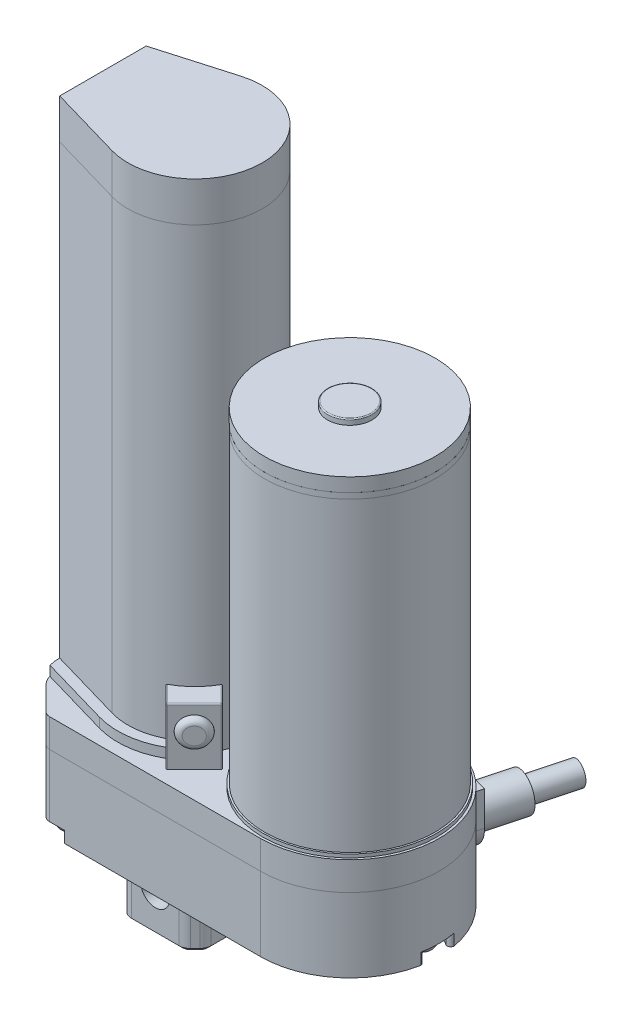
from build123d import *

# Parameters (mm, degrees)
BOSS_EXTRUDE1_DEPTH      = 6.35
SKETCH6_R                = 19.431
BOSS_EXTRUDE4_DEPTH      = 0.762
SKETCH7_R                = 19.05
BOSS_EXTRUDE5_DEPTH      = 68.326
FILLET6_R                = 5.08
FILLET7_R                = 1.905
BOSS_EXTRUDE15_DEPTH     = 6.35
SKETCH24_R               = 4.064
BOSS_EXTRUDE16_DEPTH     = 10.16
SKETCH25_R               = 2.54
BOSS_EXTRUDE17_DEPTH     = 10.16
BOSS_EXTRUDE19_DEPTH     = 16.51
FILLET13_R               = 1.905
FILLET14_R               = 5.08
BOSS_EXTRUDE20_DEPTH     = 18.796
CHAMFER1_SIZE            = 2.54
FILLET15_R               = 2.54
CHAMFER2_SIZE            = 0.762
SKETCH27_R               = 3.175
CUT_EXTRUDE3_DEPTH       = 19.05
SKETCH28_R               = 19.05
BOSS_EXTRUDE22_DEPTH     = 1.27
SKETCH29_R               = 19.05
BOSS_EXTRUDE24_DEPTH     = 3.048
BOSS_EXTRUDE25_START     = 4.318
SKETCH8_R                = 4.953
BOSS_EXTRUDE25_DEPTH     = 1.27
FILLET16_R               = 0.2286
BOSS_EXTRUDE26_DEPTH     = 101.981
BOSS_EXTRUDE27_DEPTH     = 8.89
SKETCH33_R               = 9.906
BOSS_EXTRUDE28_DEPTH     = 21.336
BOSS_EXTRUDE30_DEPTH     = 2.159
BOSS_EXTRUDE31_DEPTH     = 2.159
BOSS_EXTRUDE33_DEPTH     = 12.7
BOSS_EXTRUDE33_2_DEPTH   = 12.7
FILLET17_R               = 0.2286
FILLET18_R               = 0.2286
SKETCH43_R               = 3.175
BOSS_EXTRUDE34_DEPTH     = 1.27
FILLET19_R               = 1.27
SKETCH44_R               = 3.175
BOSS_EXTRUDE35_DEPTH     = 1.27
FILLET20_R               = 1.27
CUT_EXTRUDE5_START       = -2.54
CUT_EXTRUDE5_DEPTH       = 2.54
CUT_EXTRUDE6_START       = -2.54
CUT_EXTRUDE6_DEPTH       = 2.54
SKETCH47_R               = 2.54
BOSS_EXTRUDE36_DEPTH     = 2.54
BOSS_EXTRUDE36_2_DEPTH   = 2.54
BOSS_EXTRUDE36_3_DEPTH   = 2.54
FILLET22_R               = 1.524
FILLET23_R               = 1.524
SKETCH48_R               = 3.81
BOSS_EXTRUDE37_DEPTH     = 1.524
FILLET24_R               = 1.524
FILLET25_R               = 1.524
SKETCH49_R               = 3.81
CUT_EXTRUDE7_DEPTH       = 2.54
SKETCH50_R               = 3.556
BOSS_EXTRUDE39_DEPTH     = 2.54
CUT_EXTRUDE11_DEPTH      = 166.213624927
CUT_EXTRUDE11_DEPTH_BACK = 166.213624927
SKETCH52_R               = 3.175
SKETCH54_R               = 9.906
CUT_EXTRUDE12_DEPTH      = 21.336


with BuildPart() as part:
    # Sketch1 → Boss-Extrude1 (new body)
    with BuildSketch(Plane(origin=(0, 0, 0), x_dir=(1, 0, 0), z_dir=(0, 1, 0))):
        with BuildLine():
            Line((0, 32.639), (7.239, 39.878))
            Line((7.239, 39.878), (55.118, 39.878))
            ThreePointArc((55.118, 39.878), (75.057, 19.939), (55.118, 0))
            Line((55.118, 0), (7.239, 0))
            Line((7.239, 0), (0, 7.239))
            Line((0, 7.239), (0, 32.639))
        make_face()
    extrude(amount=BOSS_EXTRUDE1_DEPTH)

    # Fillet6
    fillet6_edges = [part.edges().sort_by_distance(p)[0] for p in [
        (0, 3.175, -7.239),
        (0, 3.175, -32.639),
    ]]
    fillet(fillet6_edges, radius=FILLET6_R)

    # Fillet7
    fillet7_edges = [part.edges().sort_by_distance(p)[0] for p in [
        (7.239, 3.175, 0),
        (7.239, 3.175, -39.878),
    ]]
    fillet(fillet7_edges, radius=FILLET7_R)


with BuildPart() as body_2:
    # Sketch6 → Boss-Extrude4 (new body)
    with BuildSketch(Plane(origin=(0, 6.35, 0), x_dir=(1, 0, 0), z_dir=(0, 1, 0))):
        with Locations(Location((55.118, 19.939, 0), (0, 0, 90))):
            Circle(SKETCH6_R)
    extrude(amount=BOSS_EXTRUDE4_DEPTH)


with BuildPart() as body_3:
    # Sketch7 → Boss-Extrude5 (new body)
    with BuildSketch(Plane(origin=(0, 7.112, 0), x_dir=(1, 0, 0), z_dir=(0, 1, 0))):
        with Locations(Location((55.118, 19.939, 0), (0, 0, 270))):
            Circle(SKETCH7_R)
    extrude(amount=BOSS_EXTRUDE5_DEPTH)


with BuildPart() as body_4:
    # Sketch23 → Boss-Extrude15 (new body)
    with BuildSketch(Plane(origin=(12.522748088, 0, -46.735532116), x_dir=(0, -1, 0), z_dir=(0.25881904510252135, 0, -0.9659258262890681))):
        with BuildLine():
            Line((-2.032, -53.883866243), (5.588, -53.883866243))
            ThreePointArc((5.588, -53.883866243), (11.303, -48.168866243), (5.588, -42.453866243))
            Line((5.588, -42.453866243), (-2.032, -42.453866243))
            Line((-2.032, -42.453866243), (-2.032, -53.883866243))
        make_face()
    extrude(amount=BOSS_EXTRUDE15_DEPTH)

    # Sketch24 → Boss-Extrude16 (add)
    with BuildSketch(Plane(origin=(14.166249025, 0, -52.869161113), x_dir=(-0.9659258262890682, 0, -0.25881904510252135), z_dir=(0.2588190451025213, 0, -0.9659258262890681))):
        with Locations((-48.168866243, -5.588)):
            Circle(SKETCH24_R)
    extrude(amount=BOSS_EXTRUDE16_DEPTH)

    # Sketch25 → Boss-Extrude17 (add)
    with BuildSketch(Plane(origin=(16.795850523, 0, -62.682967508), x_dir=(-0.9659258262890681, 0, -0.25881904510252135), z_dir=(0.25881904510252135, 0, -0.9659258262890681))):
        with Locations((-48.168866243, -5.588)):
            Circle(SKETCH25_R)
    extrude(amount=BOSS_EXTRUDE17_DEPTH)


with BuildPart() as body_5:
    # Sketch1<3> → Boss-Extrude19 (new body)
    with BuildSketch(Plane(origin=(0, 0, 0), x_dir=(1, 0, 0), z_dir=(0, 1, 0))):
        with BuildLine():
            Line((0, 32.639), (7.239, 39.878))
            Line((7.239, 39.878), (55.118, 39.878))
            ThreePointArc((55.118, 39.878), (75.057, 19.939), (55.118, 0))
            Line((55.118, 0), (7.239, 0))
            Line((7.239, 0), (0, 7.239))
            Line((0, 7.239), (0, 32.639))
        make_face()
    extrude(amount=-BOSS_EXTRUDE19_DEPTH)

    # Fillet13
    fillet13_edges = [body_5.edges().sort_by_distance(p)[0] for p in [
        (7.239, -8.255, 0),
        (7.239, -8.255, -39.878),
    ]]
    fillet(fillet13_edges, radius=FILLET13_R)

    # Fillet14
    fillet14_edges = [body_5.edges().sort_by_distance(p)[0] for p in [
        (0, -8.255, -7.239),
        (0, -8.255, -32.639),
    ]]
    fillet(fillet14_edges, radius=FILLET14_R)

    # Sketch45 → Cut-Extrude5 (cut)
    with BuildSketch(Plane.XZ.offset(16.51).offset(CUT_EXTRUDE5_START)):
        with BuildLine():
            ThreePointArc((5.044290367, -35.978344089), (4.718699387, -36.549691761), (4.084467985, -36.723467985))
            Line((4.084467985, -36.723467985), (6.681038418, -39.320038418))
            ThreePointArc((6.681038418, -39.320038418), (7.299064898, -39.732990509), (8.028076836, -39.878))
            Line((8.028076836, -39.878), (11.393838428, -39.878))
            ThreePointArc((11.393838428, -39.878), (11.138454644, -39.419455597), (11.282110896, -38.914632134))
            ThreePointArc((11.282110896, -38.914632134), (10.476958507, -32.531164357), (5.044290367, -35.978344089))
        make_face()
        with BuildLine():
            ThreePointArc((11.282110896, -0.963367866), (11.138454644, -0.458544403), (11.393838428, 0))
            Line((11.393838428, 0), (8.028076836, 0))
            ThreePointArc((8.028076836, 0), (7.299064898, -0.145009491), (6.681038418, -0.557961582))
            Line((6.681038418, -0.557961582), (4.084467985, -3.154532015))
            ThreePointArc((4.084467985, -3.154532015), (4.718699387, -3.328308239), (5.044290367, -3.899655911))
            ThreePointArc((5.044290367, -3.899655911), (10.476958507, -7.346835643), (11.282110896, -0.963367866))
        make_face()
    extrude(amount=CUT_EXTRUDE5_DEPTH, mode=Mode.SUBTRACT)

    # Sketch45<3> → Cut-Extrude6 (cut)
    with BuildSketch(Plane.XZ.offset(16.51).offset(CUT_EXTRUDE6_START)):
        with BuildLine():
            Line((4.084467985, -36.723467985), (6.681038418, -39.320038418))
            ThreePointArc((6.681038418, -39.320038418), (7.299064898, -39.732990509), (8.028076836, -39.878))
            Line((8.028076836, -39.878), (11.393838428, -39.878))
            ThreePointArc((11.393838428, -39.878), (11.138454644, -39.419455597), (11.282110896, -38.914632134))
            ThreePointArc((11.282110896, -38.914632134), (10.476958507, -32.531164357), (5.044290367, -35.978344089))
            ThreePointArc((5.044290367, -35.978344089), (4.718699387, -36.549691761), (4.084467985, -36.723467985))
        make_face()
        with BuildLine():
            Line((11.393838428, 0), (8.028076836, 0))
            ThreePointArc((8.028076836, 0), (7.299064898, -0.145009491), (6.681038418, -0.557961582))
            Line((6.681038418, -0.557961582), (4.084467985, -3.154532015))
            ThreePointArc((4.084467985, -3.154532015), (4.718699387, -3.328308239), (5.044290367, -3.899655911))
            ThreePointArc((5.044290367, -3.899655911), (10.476958507, -7.346835643), (11.282110896, -0.963367866))
            ThreePointArc((11.282110896, -0.963367866), (11.138454644, -0.458544403), (11.393838428, 0))
        make_face()
        with BuildLine():
            ThreePointArc((73.662109712, -16.992248385), (67.437, -19.939), (73.662109712, -22.885751615))
            ThreePointArc((73.662109712, -22.885751615), (74.341584064, -23.041280193), (74.712069674, -23.631716426))
            ThreePointArc((74.712069674, -23.631716426), (75.057, -19.939), (74.712069674, -16.246283574))
            ThreePointArc((74.712069674, -16.246283574), (74.341584064, -16.836719807), (73.662109712, -16.992248385))
        make_face()
    extrude(amount=CUT_EXTRUDE6_DEPTH, mode=Mode.SUBTRACT)


with BuildPart() as body_6:
    # Sketch26 → Boss-Extrude20 (new body)
    with BuildSketch(Plane(origin=(0, -16.51, 0), x_dir=(-1, 0, 0), z_dir=(0, -1, 0))):
        Polygon((-20.574, 28.829), (-11.684, 28.829), (-11.684, 11.049), (-29.464, 11.049), (-29.464, 28.829), align=None)
    extrude(amount=BOSS_EXTRUDE20_DEPTH)

    # Chamfer1
    chamfer1_edges = [body_6.edges().sort_by_distance(p)[0] for p in [
        (11.684, -25.908, -11.049),
        (29.464, -25.908, -11.049),
        (29.464, -25.908, -28.829),
        (11.684, -25.908, -28.829),
    ]]
    chamfer(chamfer1_edges, length=CHAMFER1_SIZE)

    # Fillet15
    fillet15_edges = [body_6.edges().sort_by_distance(p)[0] for p in [
        (29.464, -25.908, -13.589),
        (29.464, -25.908, -26.289),
        (14.224, -25.908, -28.829),
        (26.924, -25.908, -28.829),
        (14.224, -25.908, -11.049),
        (26.924, -25.908, -11.049),
        (11.684, -25.908, -26.289),
        (11.684, -25.908, -13.589),
    ]]
    fillet(fillet15_edges, radius=FILLET15_R)

    # Chamfer2
    chamfer2_edges = [body_6.edges().sort_by_distance(p)[0] for p in [
        (11.684, -35.306, -19.939),
        (12.954, -35.306, -12.319),
        (20.574, -35.306, -28.829),
        (28.194, -35.306, -27.559),
        (29.464, -35.306, -19.939),
        (28.194, -35.306, -12.319),
        (20.574, -35.306, -11.049),
        (12.954, -35.306, -27.559),
        (14.30408653, -35.306, -28.635654013),
        (11.877345987, -35.306, -26.20891347),
        (26.84391347, -35.306, -28.635654013),
        (29.270654013, -35.306, -26.20891347),
        (29.270654013, -35.306, -13.66908653),
        (26.84391347, -35.306, -11.242345987),
        (14.30408653, -35.306, -11.242345987),
        (11.877345987, -35.306, -13.66908653),
    ]]
    chamfer(chamfer2_edges, length=CHAMFER2_SIZE)

    # Sketch27 → Cut-Extrude3 (cut)
    with BuildSketch(Plane.XY.offset(-11.049)):
        with Locations((20.574, -26.67)):
            Circle(SKETCH27_R)
    extrude(amount=-CUT_EXTRUDE3_DEPTH, mode=Mode.SUBTRACT)


with BuildPart() as body_7:
    # Sketch28 → Boss-Extrude22 (new body)
    with BuildSketch(Plane(origin=(0, 75.438, 0), x_dir=(1, 0, 0), z_dir=(0, 1, 0))):
        with Locations(Location((55.118, 19.939, 0), (0, 0, 270))):
            Circle(SKETCH28_R)
    extrude(amount=BOSS_EXTRUDE22_DEPTH)


with BuildPart() as body_8:
    # Sketch29 → Boss-Extrude24 (new body)
    with BuildSketch(Plane(origin=(0, 76.708, 0), x_dir=(1, 0, 0), z_dir=(0, 1, 0))):
        with Locations(Location((55.118, 19.939, 0), (0, 0, 90))):
            Circle(SKETCH29_R)
    extrude(amount=BOSS_EXTRUDE24_DEPTH)

    # Sketch8 → Boss-Extrude25 (add)
    with BuildSketch(Plane(origin=(0, 75.438, 0), x_dir=(1, 0, 0), z_dir=(0, 1, 0)).offset(BOSS_EXTRUDE25_START)):
        with Locations(Location((55.118, 19.939, 0), (0, 0, 270))):
            Circle(SKETCH8_R)
    extrude(amount=BOSS_EXTRUDE25_DEPTH)

    # Fillet16
    fillet16_edges = [body_8.edges().sort_by_distance(p)[0] for p in [
        (55.118, 81.026, -24.892),
    ]]
    fillet(fillet16_edges, radius=FILLET16_R)


with BuildPart() as body_9:
    # Sketch15 → Boss-Extrude26 (new body)
    with BuildSketch(Plane(origin=(0, 6.35, 0), x_dir=(1, 0, 0), z_dir=(0, 1, 0))):
        with BuildLine():
            Line((0, 19.939), (0, 10.286870396))
            Line((0, 10.286870396), (16.411980417, 5.54225678))
            ThreePointArc((16.411980417, 5.54225678), (35.560281138, 19.939054609), (16.411875495, 34.335712887))
            Line((16.411875495, 34.335712887), (0, 29.591))
            Line((0, 29.591), (0, 19.939))
        make_face()
    extrude(amount=BOSS_EXTRUDE26_DEPTH)

    # Sketch48 → Boss-Extrude37 (add)
    with BuildSketch(Plane.ZY):
        with Locations(Location((-19.939, 12.7, 0), (0, 0, 180))):
            Circle(SKETCH48_R)
    extrude(amount=BOSS_EXTRUDE37_DEPTH)

    # Fillet24
    fillet24_edges = [body_9.edges().sort_by_distance(p)[0] for p in [
        (-1.524, 12.7, -16.129),
    ]]
    fillet(fillet24_edges, radius=FILLET24_R - 0.0001)  # a hair under: the kernel refuses the full size

    # Sketch49 → Cut-Extrude7 (cut)
    with BuildSketch(Plane.ZY):
        with Locations((-19.938935198, 103.378)):
            Circle(SKETCH49_R)
    extrude(amount=-CUT_EXTRUDE7_DEPTH, mode=Mode.SUBTRACT)

    # Sketch50 → Boss-Extrude39 (add)
    with BuildSketch(Plane.ZY.offset(-2.54)):
        with Locations((-19.938935198, 103.378)):
            Circle(SKETCH50_R)
    extrude(amount=BOSS_EXTRUDE39_DEPTH)


with BuildPart() as body_10:
    # Sketch32 → Boss-Extrude27 (new body)
    with BuildSketch(Plane(origin=(0, 108.331, 0), x_dir=(1, 0, 0), z_dir=(0, 1, 0))):
        with BuildLine():
            Line((0, 10.286870396), (0, 29.591))
            Line((0, 29.591), (16.411875495, 34.335712887))
            ThreePointArc((16.411875495, 34.335712887), (35.560281138, 19.939054609), (16.411980417, 5.54225678))
            Line((16.411980417, 5.54225678), (0, 10.286870396))
        make_face()
    extrude(amount=BOSS_EXTRUDE27_DEPTH)

    # Sketch33 → Boss-Extrude28 (add)
    with BuildSketch(Plane(origin=(0, 117.221, 0), x_dir=(1, 0, 0), z_dir=(0, 1, 0))):
        with Locations(Location((20.574, 19.939, 0), (0, 0, 270))):
            Circle(SKETCH33_R)
    extrude(amount=BOSS_EXTRUDE28_DEPTH)

    # Sketch52 → Cut-Extrude11 (cut, two sides: drawn at the far end of the back side and taken through both)
    with BuildSketch(Plane.XY.offset(-11.049).offset(-CUT_EXTRUDE11_DEPTH_BACK)):
        with Locations(Location((20.574, 129.032, 0), (0, 0, 89.99999999))):
            Circle(SKETCH52_R)
    extrude(amount=CUT_EXTRUDE11_DEPTH + CUT_EXTRUDE11_DEPTH_BACK, mode=Mode.SUBTRACT)

    # Sketch54 → Cut-Extrude12 (cut)
    with BuildSketch(Plane(origin=(0, 138.557, 0), x_dir=(1, 0, 0), z_dir=(0, 1, 0))):
        with Locations((20.574, 19.939)):
            Circle(SKETCH54_R)
    extrude(amount=-CUT_EXTRUDE12_DEPTH, mode=Mode.SUBTRACT)


with BuildPart() as body_11:
    # Sketch41 → Boss-Extrude30 (new body)
    with BuildSketch(Plane(origin=(0, 6.35, 0), x_dir=(1, 0, 0), z_dir=(0, 1, 0))):
        with BuildLine():
            Line((0, 29.591), (16.411875495, 34.335712887))
            ThreePointArc((16.411875495, 34.335712887), (22.021175201, 34.855243035), (27.425990452, 33.267122493))
            Line((27.425990452, 33.267122493), (29.11221422, 34.953346261))
            ThreePointArc((29.11221422, 34.953346261), (22.604273469, 37.091541659), (15.776987058, 36.531780434))
            Line((15.776987058, 36.531780434), (0.2736806, 32.049737053))
            Line((0.2736806, 32.049737053), (0, 30.534795103))
            Line((0, 30.534795103), (0, 29.591))
        make_face()
    extrude(amount=BOSS_EXTRUDE30_DEPTH)


with BuildPart() as body_12:
    # Sketch41<11> → Boss-Extrude31 (new body)
    with BuildSketch(Plane(origin=(0, 6.35, 0), x_dir=(1, 0, 0), z_dir=(0, 1, 0))):
        with BuildLine():
            Line((16.411875495, 5.542157508), (0, 10.286870396))
            Line((0, 10.286870396), (0, 9.343204897))
            Line((0, 9.343204897), (0, 9.343075292))
            Line((0, 9.343075292), (0.2736806, 7.828133343))
            Line((0.2736806, 7.828133343), (15.776987058, 3.346089961))
            ThreePointArc((15.776987058, 3.346089961), (22.604273469, 2.786328737), (29.11221422, 4.924524135))
            Line((29.11221422, 4.924524135), (27.425990452, 6.610747903))
            ThreePointArc((27.425990452, 6.610747903), (22.021175201, 5.02262736), (16.411875495, 5.542157508))
        make_face()
    extrude(amount=BOSS_EXTRUDE31_DEPTH)


with BuildPart() as body_13:
    # Sketch41<12> → Boss-Extrude33 (new body)
    with BuildSketch(Plane(origin=(0, 6.35, 0), x_dir=(1, 0, 0), z_dir=(0, 1, 0))):
        with BuildLine():
            Line((29.11221422, 34.953346261), (27.425990452, 33.267122493))
            ThreePointArc((27.425990452, 33.267122493), (31.070982239, 30.634886416), (33.77116823, 27.039941701))
            Line((33.77116823, 27.039941701), (37.542875801, 30.811649272))
            Line((37.542875801, 30.811649272), (31.256696516, 37.097828557))
            Line((31.256696516, 37.097828557), (29.11221422, 34.953346261))
        make_face()
    extrude(amount=BOSS_EXTRUDE33_DEPTH)

    # Fillet17
    fillet17_edges = [body_13.edges().sort_by_distance(p)[0] for p in [
        (35.657022016, 19.05, -28.925795487),
        (34.399786159, 19.05, -33.954738915),
        (29.341343484, 19.05, -35.182475525),
        (31.256696516, 12.7, -37.097828557),
        (37.542875801, 12.7, -30.811649272),
    ]]
    fillet(fillet17_edges, radius=FILLET17_R)


with BuildPart() as body_14:
    # Sketch41<12> → Boss-Extrude33 2 (new body)
    with BuildSketch(Plane(origin=(0, 6.35, 0), x_dir=(1, 0, 0), z_dir=(0, 1, 0))):
        with BuildLine():
            Line((31.256696516, 2.780041839), (37.542875801, 9.066221123))
            Line((37.542875801, 9.066221123), (33.77116823, 12.837928694))
            ThreePointArc((33.77116823, 12.837928694), (31.070982239, 9.24298398), (27.425990452, 6.610747903))
            Line((27.425990452, 6.610747903), (29.11221422, 4.924524135))
            Line((29.11221422, 4.924524135), (31.256696516, 2.780041839))
        make_face()
    extrude(amount=BOSS_EXTRUDE33_2_DEPTH)

    # Fillet18
    fillet18_edges = [body_14.edges().sort_by_distance(p)[0] for p in [
        (34.399786159, 19.05, -5.923131481),
        (35.657022016, 19.05, -10.952074909),
        (29.341343484, 19.05, -4.695394871),
        (37.542875801, 12.7, -9.066221123),
        (31.256696516, 12.7, -2.780041839),
    ]]
    fillet(fillet18_edges, radius=FILLET18_R)


with BuildPart() as body_15:
    # Sketch43 → Boss-Extrude34 (new body)
    with BuildSketch(Plane(origin=(34.177262537, 0, -34.177262537), x_dir=(-0.7071067811865481, 0, -0.7071067811865469), z_dir=(0.7071067811865469, 0, -0.7071067811865481))):
        with Locations(Location((-0.314695924, 13.7414, 0), (0, 0, 180))):
            Circle(SKETCH43_R)
    extrude(amount=BOSS_EXTRUDE34_DEPTH)

    # Fillet19
    fillet19_edges = [body_15.edges().sort_by_distance(p)[0] for p in [
        (33.052747741, 13.7414, -37.097828557),
    ]]
    fillet(fillet19_edges, radius=FILLET19_R - 0.0001)  # a hair under: the kernel refuses the full size


with BuildPart() as body_16:
    # Sketch44 → Boss-Extrude35 (new body)
    with BuildSketch(Plane(origin=(14.238327339, 0, 14.238327339), x_dir=(0.7071067811865481, 0, -0.7071067811865469), z_dir=(0.7071067811865469, 0, 0.7071067811865481))):
        with Locations(Location((28.5126085, 13.7414, 0), (0, 0, 180))):
            Circle(SKETCH44_R)
    extrude(amount=BOSS_EXTRUDE35_DEPTH)

    # Fillet20
    fillet20_edges = [body_16.edges().sort_by_distance(p)[0] for p in [
        (37.542875801, 13.7414, -7.270169899),
    ]]
    fillet(fillet20_edges, radius=FILLET20_R - 0.0001)  # a hair under: the kernel refuses the full size


with BuildPart() as body_17:
    # Sketch47 → Boss-Extrude36 (new body)
    with BuildSketch(Plane(origin=(0, -13.97, 0), x_dir=(-1, 0, 0), z_dir=(0, -1, 0))):
        with Locations(Location((-8.854290367, 35.978344089, 0), (0, 0, 90))):
            Circle(SKETCH47_R)
    extrude(amount=BOSS_EXTRUDE36_DEPTH)

    # Fillet22
    fillet22_edges = [body_17.edges().sort_by_distance(p)[0] for p in [
        (8.854290367, -16.51, -33.438344089),
    ]]
    fillet(fillet22_edges, radius=FILLET22_R)


with BuildPart() as body_18:
    # Sketch47 → Boss-Extrude36 2 (new body)
    with BuildSketch(Plane(origin=(0, -13.97, 0), x_dir=(-1, 0, 0), z_dir=(0, -1, 0))):
        with Locations(Location((-8.854290367, 3.899655911, 0), (0, 0, 90))):
            Circle(SKETCH47_R)
    extrude(amount=BOSS_EXTRUDE36_2_DEPTH)

    # Fillet23
    fillet23_edges = [body_18.edges().sort_by_distance(p)[0] for p in [
        (8.854290367, -16.51, -1.359655911),
    ]]
    fillet(fillet23_edges, radius=FILLET23_R)


with BuildPart() as body_19:
    # Sketch47 → Boss-Extrude36 3 (new body)
    with BuildSketch(Plane(origin=(0, -13.97, 0), x_dir=(-1, 0, 0), z_dir=(0, -1, 0))):
        with Locations(Location((-71.247, 19.939, 0), (0, 0, 90))):
            Circle(SKETCH47_R)
    extrude(amount=BOSS_EXTRUDE36_3_DEPTH)

    # Fillet25
    fillet25_edges = [body_19.edges().sort_by_distance(p)[0] for p in [
        (71.247, -16.51, -17.399),
    ]]
    fillet(fillet25_edges, radius=FILLET25_R)


solid = Compound([part.part, body_2.part, body_3.part, body_4.part, body_5.part, body_6.part, body_7.part, body_8.part, body_9.part, body_10.part, body_11.part, body_12.part, body_13.part, body_14.part, body_15.part, body_16.part, body_17.part, body_18.part, body_19.part])
